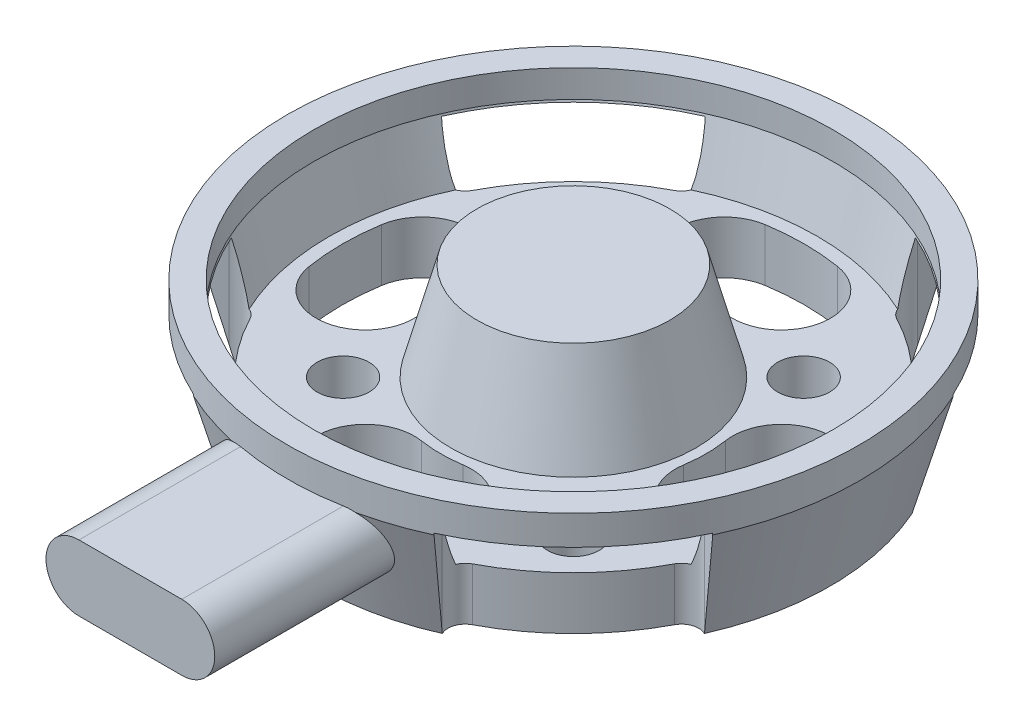
from build123d import *

# Parameters (mm, degrees)
SHELL2_T                   = -1.27
CUT_EXTRUDE1_START         = -5.1816
CUT_EXTRUDE1_DEPTH         = 5.1816
CUT_EXTRUDE2_REACH         = 26.739
SKETCH4_R                  = 12.5095
BOSS_EXTRUDE3_START        = -1.27
BOSS_EXTRUDE3_DEPTH        = 1.27
SKETCH8_W                  = 1.25
SKETCH8_H                  = 20.574
M3_TAPPED_HOLE1_AT_2_COUNT = 2
M3_TAPPED_HOLE1_AT_2_PITCH = 15.6845
M3_TAPPED_HOLE1_AT_3_COUNT = 2
M3_TAPPED_HOLE1_AT_3_PITCH = 12.191545239
M3_TAPPED_HOLE1_AT_4_COUNT = 2
M3_TAPPED_HOLE1_AT_4_PITCH = 12.191545239
BOSS_EXTRUDE7_START        = 11.43
BOSS_EXTRUDE7_DEPTH        = 9.906
SKETCH15_R                 = 13.7795
CUT_EXTRUDE3_DEPTH         = 13.97
SKETCH16_R                 = 5.9055
BOSS_EXTRUDE8_DEPTH        = 4.699
BOSS_EXTRUDE8_TAPER        = 15
SKETCH18_R                 = 3.937
CUT_EXTRUDE4_DEPTH         = 0.635
CHAMFER1_SIZE              = 0.0635


# Read off the part's stored shape, not the designer's step: Cut-Extrude1
with BuildPart() as part:
    # Sketch2 → Revolve1 (revolve)
    with BuildSketch(Plane.XY, mode=Mode.PRIVATE) as revolve1_sk:
        Polygon((0, 0), (12.36345, 0), (13.7795, 5.1054), (13.7795, 6.604), (11.2395, 6.604), (11.2395, 7.2136), (13.7795, 7.2136), (13.7795, 17.3736), (8.15975, 20.574), (0, 20.574), align=None)
    revolve(revolve1_sk.sketch.rotate(Axis((0, 20.574, 0), (0, -1, 0)), 180), axis=Axis((0, 20.574, 0), (0, -1, 0)))

    # Shell2
    shell2_openings = [part.faces().sort_by_distance(p)[0] for p in [
        (0, 20.574, 0),
    ]]
    offset(amount=SHELL2_T, openings=shell2_openings, kind=Kind.INTERSECTION)

    # Cut-Extrude1 outline → Cut-Extrude1 (cut)
    with BuildSketch(Plane.XZ.offset(CUT_EXTRUDE1_START)):
        with BuildLine():
            ThreePointArc((-6.315224612, 1.00345847), (-8.277465928, 3.707083203), (-10.981090661, 1.744841887))
            ThreePointArc((-10.981090661, 1.744841887), (-11.11885, 0), (-10.981090661, -1.744841887))
            ThreePointArc((-10.981090661, -1.744841887), (-8.277465928, -3.707083203), (-6.315224612, -1.00345847))
            ThreePointArc((-6.315224612, -1.00345847), (-6.39445, 0), (-6.315224612, 1.00345847))
        make_face()
        with BuildLine():
            ThreePointArc((1.00345847, 6.315224612), (3.707083203, 8.277465928), (1.744841887, 10.981090661))
            ThreePointArc((1.744841887, 10.981090661), (0, 11.11885), (-1.744841887, 10.981090661))
            ThreePointArc((-1.744841887, 10.981090661), (-3.707083203, 8.277465928), (-1.00345847, 6.315224612))
            ThreePointArc((-1.00345847, 6.315224612), (0, 6.39445), (1.00345847, 6.315224612))
        make_face()
        with BuildLine():
            ThreePointArc((6.315224612, -1.00345847), (8.277465928, -3.707083203), (10.981090661, -1.744841887))
            ThreePointArc((10.981090661, -1.744841887), (11.11885, 0), (10.981090661, 1.744841887))
            ThreePointArc((10.981090661, 1.744841887), (8.277465928, 3.707083203), (6.315224612, 1.00345847))
            ThreePointArc((6.315224612, 1.00345847), (6.39445, 0), (6.315224612, -1.00345847))
        make_face()
        with BuildLine():
            ThreePointArc((-1.00345847, -6.315224612), (-3.707083203, -8.277465928), (-1.744841887, -10.981090661))
            ThreePointArc((-1.744841887, -10.981090661), (0, -11.11885), (1.744841887, -10.981090661))
            ThreePointArc((1.744841887, -10.981090661), (3.707083203, -8.277465928), (1.00345847, -6.315224612))
            ThreePointArc((1.00345847, -6.315224612), (0, -6.39445), (-1.00345847, -6.315224612))
        make_face()
        with BuildLine():
            Line((-5.791454898, -12.503346369), (-5.009994838, -11.33297392))
            ThreePointArc((-5.009994838, -11.33297392), (-4.953074519, -10.703732795), (-5.357766444, -10.218543386))
            ThreePointArc((-5.357766444, -10.218543386), (-8.158562686, -8.158562686), (-10.218543388, -5.357766441))
            ThreePointArc((-10.218543388, -5.357766441), (-10.703732797, -4.953074519), (-11.33297392, -5.009994838))
            Line((-11.33297392, -5.009994838), (-12.503346369, -5.791454898))
            ThreePointArc((-12.503346369, -5.791454898), (-9.743577891, -9.743577891), (-5.791454898, -12.503346369))
        make_face()
        with BuildLine():
            Line((5.10681701, -11.477981973), (5.791454898, -12.503346369))
            ThreePointArc((5.791454898, -12.503346369), (9.743577891, -9.743577891), (12.503346369, -5.791454898))
            Line((12.503346369, -5.791454898), (11.477981973, -5.10681701))
            ThreePointArc((11.477981973, -5.10681701), (10.788330572, -4.931510777), (10.218543386, -5.357766444))
            ThreePointArc((10.218543386, -5.357766444), (8.158562686, -8.158562686), (5.357766441, -10.218543388))
            ThreePointArc((5.357766441, -10.218543388), (4.931510776, -10.788330573), (5.10681701, -11.477981973))
        make_face()
        with BuildLine():
            ThreePointArc((-5.791454898, 12.503346369), (-9.743577891, 9.743577891), (-12.503346369, 5.791454898))
            Line((-12.503346369, 5.791454898), (-11.47798216, 5.106817165))
            ThreePointArc((-11.47798216, 5.106817165), (-10.788330691, 4.931510753), (-10.218543386, 5.357766444))
            ThreePointArc((-10.218543386, 5.357766444), (-8.158562686, 8.158562686), (-5.357766441, 10.218543388))
            ThreePointArc((-5.357766441, 10.218543388), (-4.931510753, 10.788330692), (-5.106817165, 11.47798216))
            Line((-5.106817165, 11.47798216), (-5.791454898, 12.503346369))
        make_face()
        with BuildLine():
            ThreePointArc((12.503346369, 5.791454898), (9.743577891, 9.743577891), (5.791454898, 12.503346369))
            Line((5.791454898, 12.503346369), (5.009994838, 11.33297392))
            ThreePointArc((5.009994838, 11.33297392), (4.953074519, 10.703732795), (5.357766444, 10.218543386))
            ThreePointArc((5.357766444, 10.218543386), (8.158562686, 8.158562686), (10.218543388, 5.357766441))
            ThreePointArc((10.218543388, 5.357766441), (10.703732797, 4.953074519), (11.33297392, 5.009994838))
            Line((11.33297392, 5.009994838), (12.503346369, 5.791454898))
        make_face()
    extrude(amount=CUT_EXTRUDE1_DEPTH, mode=Mode.SUBTRACT)

    # Sketch4 → Cut-Extrude2 (cut, up to next)
    with BuildSketch(Plane.XZ.offset(-5.334), mode=Mode.PRIVATE) as cut_extrude2_sk1:
        with Locations(Location((0, 0, 0), (0, 0, 180))):
            Circle(SKETCH4_R)
    cut_extrude2_tool1 = extrude(cut_extrude2_sk1.sketch, amount=-CUT_EXTRUDE2_REACH, mode=Mode.PRIVATE) & part.part
    add(cut_extrude2_tool1.solids().sort_by_distance((0, 5.334, 0))[0], mode=Mode.SUBTRACT)


with BuildPart() as cut_extrude2_piece_1:
    # of the separate pieces the step leaves, piece 1, a body of its own (cut_extrude2_pieces)
    add(part.part.solids().sort_by_distance((-12.5095, 8.4836, 0))[0])

    # Sketch15 → Cut-Extrude3 (cut)
    with BuildSketch(Plane(origin=(0, 20.574, 0), x_dir=(1, 0, 0), z_dir=(0, 1, 0))):
        with Locations(Location((0, 0, 0), (0, 0, 180))):
            Circle(SKETCH15_R)
    extrude(amount=-CUT_EXTRUDE3_DEPTH, mode=Mode.SUBTRACT)


with BuildPart() as cut_extrude2_piece_2:
    # of the separate pieces the step leaves, piece 2, a body of its own (cut_extrude2_pieces)
    add(part.part.solids().sort_by_distance((-10.218543388, 0, -5.357766441))[0])

    # Sketch5 → Boss-Extrude3 (add)
    with BuildSketch(Plane.XZ.offset(BOSS_EXTRUDE3_START)):
        with BuildLine():
            ThreePointArc((-5.357766441, 10.218543388), (-8.158562686, 8.158562686), (-10.218543388, 5.357766441))
            ThreePointArc((-10.218543388, 5.357766441), (-10.690611308, 4.957289757), (-11.308352658, 4.997605034))
            ThreePointArc((-11.308352658, 4.997605034), (-12.36345, 0), (-11.308352658, -4.997605034))
            ThreePointArc((-11.308352658, -4.997605034), (-10.690611308, -4.957289757), (-10.218543388, -5.357766441))
            ThreePointArc((-10.218543388, -5.357766441), (-8.158562686, -8.158562686), (-5.357766441, -10.218543388))
            ThreePointArc((-5.357766441, -10.218543388), (-4.957289757, -10.690611308), (-4.997605034, -11.308352658))
            ThreePointArc((-4.997605034, -11.308352658), (0, -12.36345), (4.997605034, -11.308352658))
            ThreePointArc((4.997605034, -11.308352658), (4.957289757, -10.690611308), (5.357766441, -10.218543388))
            ThreePointArc((5.357766441, -10.218543388), (8.158562686, -8.158562686), (10.218543388, -5.357766441))
            ThreePointArc((10.218543388, -5.357766441), (10.690611308, -4.957289757), (11.308352658, -4.997605034))
            ThreePointArc((11.308352658, -4.997605034), (12.36345, 0), (11.308352658, 4.997605034))
            ThreePointArc((11.308352658, 4.997605034), (10.690611308, 4.957289757), (10.218543388, 5.357766441))
            ThreePointArc((10.218543388, 5.357766441), (8.158562686, 8.158562686), (5.357766441, 10.218543388))
            ThreePointArc((5.357766441, 10.218543388), (4.957289757, 10.690611308), (4.997605034, 11.308352658))
            ThreePointArc((4.997605034, 11.308352658), (0, 12.36345), (-4.997605034, 11.308352658))
            ThreePointArc((-4.997605034, 11.308352658), (-4.957289757, 10.690611308), (-5.357766441, 10.218543388))
        make_face()
        with BuildLine():
            ThreePointArc((6.315224612, -1.00345847), (6.39445, 0), (6.315224612, 1.00345847))
            ThreePointArc((6.315224612, 1.00345847), (8.277465928, 3.707083203), (10.981090661, 1.744841887))
            ThreePointArc((10.981090661, 1.744841887), (11.11885, 0), (10.981090661, -1.744841887))
            ThreePointArc((10.981090661, -1.744841887), (8.277465928, -3.707083203), (6.315224612, -1.00345847))
        make_face(mode=Mode.SUBTRACT)
        with BuildLine():
            ThreePointArc((-1.00345847, -6.315224612), (0, -6.39445), (1.00345847, -6.315224612))
            ThreePointArc((1.00345847, -6.315224612), (3.707083203, -8.277465928), (1.744841887, -10.981090661))
            ThreePointArc((1.744841887, -10.981090661), (0, -11.11885), (-1.744841887, -10.981090661))
            ThreePointArc((-1.744841887, -10.981090661), (-3.707083203, -8.277465928), (-1.00345847, -6.315224612))
        make_face(mode=Mode.SUBTRACT)
        with BuildLine():
            ThreePointArc((-6.315224612, 1.00345847), (-6.39445, 0), (-6.315224612, -1.00345847))
            ThreePointArc((-6.315224612, -1.00345847), (-8.277465928, -3.707083203), (-10.981090661, -1.744841887))
            ThreePointArc((-10.981090661, -1.744841887), (-11.11885, 0), (-10.981090661, 1.744841887))
            ThreePointArc((-10.981090661, 1.744841887), (-8.277465928, 3.707083203), (-6.315224612, 1.00345847))
        make_face(mode=Mode.SUBTRACT)
        with BuildLine():
            ThreePointArc((1.00345847, 6.315224612), (0, 6.39445), (-1.00345847, 6.315224612))
            ThreePointArc((-1.00345847, 6.315224612), (-3.707083203, 8.277465928), (-1.744841887, 10.981090661))
            ThreePointArc((-1.744841887, 10.981090661), (0, 11.11885), (1.744841887, 10.981090661))
            ThreePointArc((1.744841887, 10.981090661), (3.707083203, 8.277465928), (1.00345847, 6.315224612))
        make_face(mode=Mode.SUBTRACT)
    extrude(amount=-BOSS_EXTRUDE3_DEPTH)

    # Sketch8 → M3 Tapped Hole1 (revolve, cut)
    with BuildSketch(Plane(origin=(-5.545308155, 0, 5.545308155), x_dir=(0, 0, -1), z_dir=(1, 0, 0))):
        with Locations((0.625, 10.287)):
            Rectangle(SKETCH8_W, SKETCH8_H)
    m3_tapped_hole1 = revolve(axis=Axis((-5.545308155, -6.35, 5.545308155), (0, 1, 0)), mode=Mode.SUBTRACT)

    # M3 Tapped Hole1 at 2: M3 Tapped Hole1 ×2
    with Locations(*[Vector(0.7071067811865464, 0, -0.7071067811865487) * (i * M3_TAPPED_HOLE1_AT_2_PITCH) for i in range(1, M3_TAPPED_HOLE1_AT_2_COUNT)]):
        add(m3_tapped_hole1, mode=Mode.SUBTRACT)

    # M3 Tapped Hole1 at 3: M3 Tapped Hole1 ×2
    with Locations(*[Vector(0.9962474949424386, 0, 0.0865501520559956) * (i * M3_TAPPED_HOLE1_AT_3_PITCH) for i in range(1, M3_TAPPED_HOLE1_AT_3_COUNT)]):
        add(m3_tapped_hole1, mode=Mode.SUBTRACT)

    # M3 Tapped Hole1 at 4: M3 Tapped Hole1 ×2
    with Locations(*[Vector(-0.0865501520559986, 0, -0.9962474949424382) * (i * M3_TAPPED_HOLE1_AT_4_PITCH) for i in range(1, M3_TAPPED_HOLE1_AT_4_COUNT)]):
        add(m3_tapped_hole1, mode=Mode.SUBTRACT)

    # Sketch14 → Boss-Extrude7 (add)
    with BuildSketch(Plane.XY.offset(BOSS_EXTRUDE7_START)):
        with BuildLine():
            Line((-2.4765, 5.1816), (2.4765, 5.1816))
            ThreePointArc((2.4765, 5.1816), (4.064, 3.5941), (2.4765, 2.0066))
            Line((2.4765, 2.0066), (-2.4765, 2.0066))
            ThreePointArc((-2.4765, 2.0066), (-4.064, 3.5941), (-2.4765, 5.1816))
        make_face()
    extrude(amount=BOSS_EXTRUDE7_DEPTH)

    # Sketch16 → Boss-Extrude8 (add)
    with BuildSketch(Plane(origin=(0, 2.54, 0), x_dir=(1, 0, 0), z_dir=(0, 1, 0))):
        Circle(SKETCH16_R)
    extrude(amount=BOSS_EXTRUDE8_DEPTH, taper=BOSS_EXTRUDE8_TAPER)

    # Sketch18 → Cut-Extrude4 (cut)
    with BuildSketch(Plane.XZ):
        Circle(SKETCH18_R)
    extrude(amount=-CUT_EXTRUDE4_DEPTH, mode=Mode.SUBTRACT)

    # Chamfer1
    chamfer1_edges = [cut_extrude2_piece_2.edges().sort_by_distance(p)[0] for p in [
        (-3.937, 0, 0),
    ]]
    chamfer(chamfer1_edges, length=CHAMFER1_SIZE)

    # Sketch17 → Revolve2 (revolve)
    with BuildSketch(Plane.XY, mode=Mode.PRIVATE) as revolve2_sk:
        Polygon((3.937, 0.635), (3.937, 0), (3.429, 0), (3.429, 0.254), (1.4986, 0.254), (1.4986, -1.7018), (0, -1.7018), (0, 0.635), align=None)
    revolve(revolve2_sk.sketch.rotate(Axis((0, -1.7018, 0), (0, 1, 0)), 90), axis=Axis((0, -1.7018, 0), (0, 1, 0)))


solid = cut_extrude2_piece_2.part
